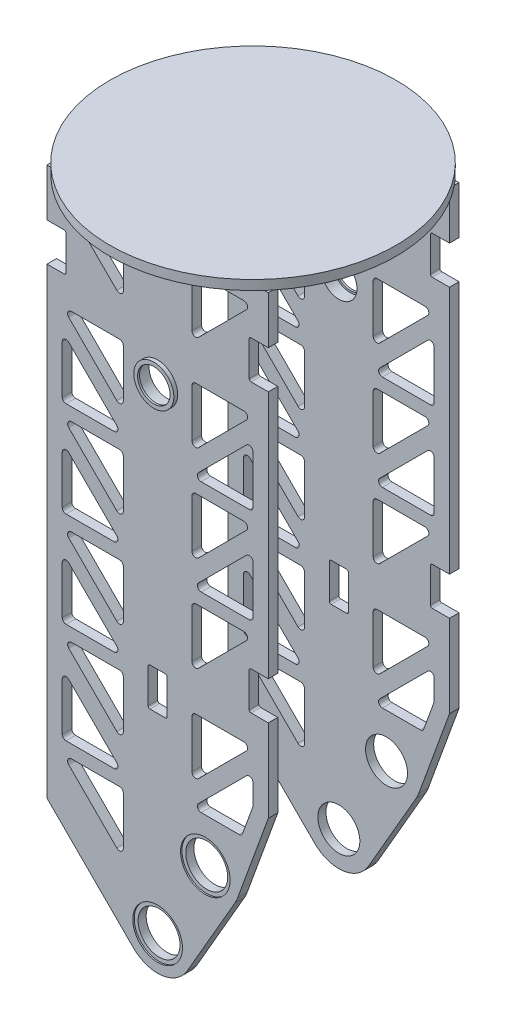
from build123d import *

# Parameters (mm, degrees)
SKETCH_1_R                   = 11
EXTRUDE_564_DEPTH            = 100
EXTRUDE_START                = -100
SKETCH_2_R                   = 11
EXTRUDE_873_DEPTH            = 100
EXTRUDE_2689_DEPTH           = 100
CUT_EXTRUDE_4146_DEPTH       = 534.010318849
CUT_EXTRUDE_4146_DEPTH_BACK  = 534.010318849
SKETCH_3_W                   = 90
SKETCH_3_H                   = 380
SKETCH_5_R                   = 2.5
EXTRUDE_4712_DEPTH           = 100
SKETCH_6_W                   = 191.177045066
SKETCH_6_H                   = 235.084722287
CUT_EXTRUDE_5026_DEPTH       = 84
SKETCH_7_R                   = 75
EXTRUDE_5314_DEPTH           = 5
CUT_EXTRUDE_6096_DEPTH       = 357.195171219
CUT_EXTRUDE_6096_DEPTH_BACK  = 357.195171219
FILLET_2_R                   = 2
MIRROR_START                 = 95
MIRROR_1_DEPTH               = 5
CUT_EXTRUDE_11149_DEPTH      = 357.195171219
CUT_EXTRUDE_11149_DEPTH_BACK = 357.195171219
SKETCH_12_W                  = 10
SKETCH_12_H                  = 20
FILLET_3_R                   = 1
CUT_EXTRUDE_START            = -5
CUT_EXTRUDE_12030_OUTLINE_R  = 5
CUT_EXTRUDE_12030_DEPTH      = 5
CUT_EXTRUDE_7_DEPTH          = 357.195171219
CUT_EXTRUDE_7_DEPTH_BACK     = 357.195171219
SKETCH_14_W                  = 10
SKETCH_14_H                  = 20
FILLET_4_R                   = 1
CUT_EXTRUDE_START_2          = -129
SKETCH_15_R                  = 11
CUT_EXTRUDE_8_DEPTH          = 129
SKETCH_16_R                  = 13
CUT_EXTRUDE_9_DEPTH          = 0.75
CUT_EXTRUDE_START_3          = -0.75
SKETCH_17_R                  = 13
CUT_EXTRUDE_10_DEPTH         = 0.75
SKETCH_18_R                  = 9.5
CUT_EXTRUDE_11_DEPTH         = 113


# Read off the part's stored shape, not the designer's step: 镜向1, 电机安装轴承孔
with BuildPart() as part:
    # 草图1 → Extrude 564 (new body)
    with BuildSketch(Plane.XY):
        with BuildLine():
            Line((-18, 500), (-18, 0))
            ThreePointArc((-18, 0), (0, -18), (18, 0))
            Line((18, 0), (18, 500))
            ThreePointArc((18, 500), (0, 518), (-18, 500))
        make_face()
        with Locations((0, 500)):
            Circle(SKETCH_1_R, mode=Mode.SUBTRACT)
        Circle(SKETCH_1_R, mode=Mode.SUBTRACT)
    extrude(amount=EXTRUDE_564_DEPTH)

    # 草图2 → Extrude 873 (add)
    with BuildSketch(Plane.XY.offset(100).offset(EXTRUDE_START)):
        with BuildLine():
            Line((18, 61.301270189), (25, 61.301270189))
            ThreePointArc((25, 61.301270189), (40.588457268, 52.301270189), (40.588457268, 34.301270189))
            Line((40.588457268, 34.301270189), (15.588457268, -9))
            ThreePointArc((15.588457268, -9), (-4.658742812, -17.386664873), (-18, 0))
            Line((-18, 0), (-18, 61.301270189))
            Line((-18, 61.301270189), (18, 61.301270189))
        make_face()
        with Locations((25, 43.301270189)):
            Circle(SKETCH_2_R, mode=Mode.SUBTRACT)
        Circle(SKETCH_2_R, mode=Mode.SUBTRACT)
    extrude(amount=EXTRUDE_873_DEPTH)

    # 草图10 → Extrude 2689 (add)
    with BuildSketch(Plane(origin=(0, 0, 0), x_dir=(-1, 0, 0), z_dir=(0, 0, -1))):
        with BuildLine():
            Line((-41.914467174, 37.144907609), (-58, 81.339545828))
            Line((-58, 81.339545828), (-58, 320))
            Line((-58, 320), (-18, 320))
            Line((-18, 320), (-18, 61.301270189))
            Line((-18, 61.301270189), (-25, 61.301270189))
            ThreePointArc((-25, 61.301270189), (-39.744736797, 53.625646044), (-41.914467174, 37.144907609))
        make_face()
        with BuildLine():
            Line((12.727922061, -12.727922061), (58, 32.544155877))
            Line((58, 32.544155877), (58, 320))
            Line((58, 320), (18, 320))
            Line((18, 320), (18, 0))
            ThreePointArc((18, 0), (16.629831585, -6.888301783), (12.727922061, -12.727922061))
        make_face()
    extrude(amount=-EXTRUDE_2689_DEPTH)

    # 草图3 → Cut-Extrude 4146 (cut, two sides: drawn at the far end of the back side and taken through both)
    with BuildSketch(Plane.ZY.offset(18).offset(-CUT_EXTRUDE_4146_DEPTH_BACK)):
        with Locations((50, 150)):
            Rectangle(SKETCH_3_W, SKETCH_3_H)
    extrude(amount=CUT_EXTRUDE_4146_DEPTH + CUT_EXTRUDE_4146_DEPTH_BACK, mode=Mode.SUBTRACT)

    # 草图5 → Extrude 4712 (add)
    with BuildSketch(Plane.XY.offset(100)):
        with Locations(Location((0, 250, 0), (0, 0, 90))):
            Circle(SKETCH_5_R)
    extrude(amount=-EXTRUDE_4712_DEPTH)

    # 草图6 → Cut-Extrude 5026 (cut)
    with BuildSketch(Plane(origin=(18, 0, 0), x_dir=(0, 0, -1), z_dir=(1, 0, 0))):
        with Locations((-50.962374235, 437.542361144)):
            Rectangle(SKETCH_6_W, SKETCH_6_H)
    extrude(amount=-CUT_EXTRUDE_5026_DEPTH, mode=Mode.SUBTRACT)

    # 草图7 → Extrude 5314 (add)
    with BuildSketch(Plane(origin=(0, 320, 0), x_dir=(1, 0, 0), z_dir=(0, 1, 0))):
        with Locations(Location((0, -50, 0), (0, 0, 320.654170234))):
            Circle(SKETCH_7_R)
    extrude(amount=EXTRUDE_5314_DEPTH)

    # 草图10<3> → Cut-Extrude 6096 (cut, two sides: drawn at the far end of the back side and taken through both)
    with BuildSketch(Plane(origin=(0, 0, 0), x_dir=(-1, 0, 0), z_dir=(0, 0, -1)).offset(-CUT_EXTRUDE_6096_DEPTH_BACK)):
        Polygon((50, 310), (18, 310), (18, 278), align=None)
        Polygon((-18, 278), (-18, 310), (-50, 310), align=None)
        Polygon((-18, 227.925713543), (-18, 259.925713543), (-50, 259.925713543), align=None)
        Polygon((50, 259.925713543), (18, 259.925713543), (18, 227.925713543), align=None)
        Polygon((50, 248.612005044), (50, 216.612005044), (18, 216.612005044), align=None)
        Polygon((-50, 248.612005044), (-50, 216.612005044), (-18, 216.612005044), align=None)
        Polygon((-18, 177.851427085), (-18, 209.851427085), (-50, 209.851427085), align=None)
        Polygon((50, 209.851427085), (18, 209.851427085), (18, 177.851427085), align=None)
        Polygon((50, 198.537718586), (50, 166.537718586), (18, 166.537718586), align=None)
        Polygon((-50, 198.537718586), (-50, 166.537718586), (-18, 166.537718586), align=None)
        Polygon((-50, 159.777140628), (-18, 127.777140628), (-18, 159.777140628), align=None)
        Polygon((18, 159.777140628), (18, 127.777140628), (50, 159.777140628), align=None)
        Polygon((-50, 109.702854171), (-18, 77.702854171), (-18, 109.702854171), align=None)
        Polygon((18, 109.702854171), (18, 77.702854171), (50, 109.702854171), align=None)
        Polygon((-50, 98.389145672), (-50, 82.750161674), (-44.045077173, 66.389145672), (-18, 66.389145672), align=None)
        Polygon((18, 56.800140588), (18, 24.800140588), (50, 56.800140588), align=None)
        Polygon((50, 95.560718547), (50, 63.560718547), (18, 63.560718547), align=None)
        Polygon((50, 116.463432129), (18, 116.463432129), (50, 148.463432129), align=None)
    extrude(amount=CUT_EXTRUDE_6096_DEPTH + CUT_EXTRUDE_6096_DEPTH_BACK, mode=Mode.SUBTRACT)

    # 圆角2
    fillet_2_edges = [part.edges().sort_by_distance(p)[0] for p in [
        (50, 109.702854171, 2.5),
        (18, 109.702854171, 2.5),
        (18, 77.702854171, 2.5),
        (-18, 159.777140628, 2.5),
        (-50, 159.777140628, 2.5),
        (-18, 127.777140628, 2.5),
        (50, 159.777140628, 2.5),
        (18, 159.777140628, 2.5),
        (18, 127.777140628, 2.5),
        (50, 166.537718586, 2.5),
        (50, 198.537718586, 2.5),
        (18, 166.537718586, 2.5),
        (-50, 63.560718547, 2.5),
        (-18, 63.560718547, 2.5),
        (-50, 95.560718547, 2.5),
        (-50, 56.800140588, 2.5),
        (-18, 24.800140588, 2.5),
        (-18, 56.800140588, 2.5),
        (50, 82.750161674, 2.5),
        (50, 98.389145672, 2.5),
        (18, 66.389145672, 2.5),
        (44.045077173, 66.389145672, 2.5),
        (-18, 109.702854171, 2.5),
        (-50, 109.702854171, 2.5),
        (-18, 77.702854171, 2.5),
        (50, 310, 2.5),
        (18, 310, 2.5),
        (18, 278, 2.5),
        (50, 259.925713543, 2.5),
        (18, 259.925713543, 2.5),
        (18, 227.925713543, 2.5),
        (-50, 248.612005044, 2.5),
        (-50, 216.612005044, 2.5),
        (-18, 216.612005044, 2.5),
        (-18, 259.925713543, 2.5),
        (-50, 259.925713543, 2.5),
        (-18, 227.925713543, 2.5),
        (50, 216.612005044, 2.5),
        (50, 248.612005044, 2.5),
        (18, 216.612005044, 2.5),
        (50, 209.851427085, 2.5),
        (18, 209.851427085, 2.5),
        (18, 177.851427085, 2.5),
        (-50, 198.537718586, 2.5),
        (-50, 166.537718586, 2.5),
        (-18, 166.537718586, 2.5),
        (-18, 209.851427085, 2.5),
        (-50, 209.851427085, 2.5),
        (-18, 177.851427085, 2.5),
        (-50, 148.463432129, 2.5),
        (-50, 116.463432129, 2.5),
        (-18, 116.463432129, 2.5),
        (-18, 310, 2.5),
        (-50, 310, 2.5),
        (-18, 278, 2.5),
    ]]
    fillet(fillet_2_edges, radius=FILLET_2_R)

    # 镜向1 outline → 镜向1 (add)
    with BuildSketch(Plane.XY.offset(MIRROR_START)):
        with BuildLine():
            ThreePointArc((-50, 143.635005004), (-48.765366865, 145.482764069), (-46.585786438, 145.049218567))
            Line((-46.585786438, 145.049218567), (-50, 148.463432129))
            Line((-50, 148.463432129), (-50, 143.635005004))
        make_face()
        with BuildLine():
            Line((-18, 116.463432129), (-21.414213562, 119.877645691))
            ThreePointArc((-21.414213562, 119.877645691), (-20.98066806, 117.698065264), (-22.828427125, 116.463432129))
            Line((-22.828427125, 116.463432129), (-18, 116.463432129))
        make_face()
        with BuildLine():
            ThreePointArc((-48, 116.463432129), (-49.414213562, 117.049218567), (-50, 118.463432129))
            Line((-50, 118.463432129), (-50, 116.463432129))
            Line((-50, 116.463432129), (-48, 116.463432129))
        make_face()
        with BuildLine():
            ThreePointArc((-20, 310), (-18.585786438, 309.414213562), (-18, 308))
            Line((-18, 308), (-18, 310))
            Line((-18, 310), (-20, 310))
        make_face()
        with BuildLine():
            Line((-18, 278), (-18, 282.828427125))
            ThreePointArc((-18, 282.828427125), (-19.234633135, 280.98066806), (-21.414213562, 281.414213562))
            Line((-21.414213562, 281.414213562), (-18, 278))
        make_face()
        with BuildLine():
            ThreePointArc((-46.585786438, 306.585786438), (-47.01933194, 308.765366865), (-45.171572875, 310))
            Line((-45.171572875, 310), (-50, 310))
            Line((-50, 310), (-46.585786438, 306.585786438))
        make_face()
        with BuildLine():
            ThreePointArc((-20, 259.925713543), (-18.585786438, 259.339927105), (-18, 257.925713543))
            Line((-18, 257.925713543), (-18, 259.925713543))
            Line((-18, 259.925713543), (-20, 259.925713543))
        make_face()
        with BuildLine():
            Line((-18, 227.925713543), (-18, 232.754140667))
            ThreePointArc((-18, 232.754140667), (-19.234633135, 230.906381602), (-21.414213562, 231.339927105))
            Line((-21.414213562, 231.339927105), (-18, 227.925713543))
        make_face()
        with BuildLine():
            ThreePointArc((-46.585786438, 256.51149998), (-47.01933194, 258.691080407), (-45.171572875, 259.925713543))
            Line((-45.171572875, 259.925713543), (-50, 259.925713543))
            Line((-50, 259.925713543), (-46.585786438, 256.51149998))
        make_face()
        with BuildLine():
            ThreePointArc((-50, 243.783577919), (-48.765366865, 245.631336984), (-46.585786438, 245.197791481))
            Line((-46.585786438, 245.197791481), (-50, 248.612005044))
            Line((-50, 248.612005044), (-50, 243.783577919))
        make_face()
        with BuildLine():
            Line((-18, 216.612005044), (-21.414213562, 220.026218606))
            ThreePointArc((-21.414213562, 220.026218606), (-20.98066806, 217.846638179), (-22.828427125, 216.612005044))
            Line((-22.828427125, 216.612005044), (-18, 216.612005044))
        make_face()
        with BuildLine():
            ThreePointArc((-48, 216.612005044), (-49.414213563, 217.197791481), (-50, 218.612005044))
            Line((-50, 218.612005044), (-50, 216.612005044))
            Line((-50, 216.612005044), (-48, 216.612005044))
        make_face()
        with BuildLine():
            ThreePointArc((-20, 209.851427085), (-18.585786438, 209.265640647), (-18, 207.851427085))
            Line((-18, 207.851427085), (-18, 209.851427085))
            Line((-18, 209.851427085), (-20, 209.851427085))
        make_face()
        with BuildLine():
            Line((-18, 177.851427085), (-18, 182.67985421))
            ThreePointArc((-18, 182.67985421), (-19.234633135, 180.832095145), (-21.414213562, 181.265640648))
            Line((-21.414213562, 181.265640648), (-18, 177.851427085))
        make_face()
        with BuildLine():
            ThreePointArc((-46.585786438, 206.437213523), (-47.01933194, 208.61679395), (-45.171572875, 209.851427085))
            Line((-45.171572875, 209.851427085), (-50, 209.851427085))
            Line((-50, 209.851427085), (-46.585786438, 206.437213523))
        make_face()
        with BuildLine():
            ThreePointArc((-50, 193.709291462), (-48.765366865, 195.557050527), (-46.585786438, 195.123505024))
            Line((-46.585786438, 195.123505024), (-50, 198.537718586))
            Line((-50, 198.537718586), (-50, 193.709291462))
        make_face()
        with BuildLine():
            Line((-18, 166.537718586), (-21.414213562, 169.951932149))
            ThreePointArc((-21.414213562, 169.951932149), (-20.98066806, 167.772351722), (-22.828427125, 166.537718586))
            Line((-22.828427125, 166.537718586), (-18, 166.537718586))
        make_face()
        with BuildLine():
            ThreePointArc((-48, 166.537718586), (-49.414213562, 167.123505024), (-50, 168.537718586))
            Line((-50, 168.537718586), (-50, 166.537718586))
            Line((-50, 166.537718586), (-48, 166.537718586))
        make_face()
        with BuildLine():
            ThreePointArc((-20, 159.777140628), (-18.585786438, 159.19135419), (-18, 157.777140628))
            Line((-18, 157.777140628), (-18, 159.777140628))
            Line((-18, 159.777140628), (-20, 159.777140628))
        make_face()
        with BuildLine():
            Line((-18, 127.777140628), (-18, 132.605567753))
            ThreePointArc((-18, 132.605567753), (-19.234633135, 130.757808688), (-21.414213562, 131.19135419))
            Line((-21.414213562, 131.19135419), (-18, 127.777140628))
        make_face()
        with BuildLine():
            ThreePointArc((-46.585786438, 156.362927066), (-47.01933194, 158.542507493), (-45.171572875, 159.777140628))
            Line((-45.171572875, 159.777140628), (-50, 159.777140628))
            Line((-50, 159.777140628), (-46.585786438, 156.362927066))
        make_face()
        with BuildLine():
            ThreePointArc((-20, 109.702854171), (-18.585786438, 109.117067733), (-18, 107.702854171))
            Line((-18, 107.702854171), (-18, 109.702854171))
            Line((-18, 109.702854171), (-20, 109.702854171))
        make_face()
        with BuildLine():
            Line((-18, 77.702854171), (-18, 82.531281295))
            ThreePointArc((-18, 82.531281295), (-19.234633135, 80.68352223), (-21.414213562, 81.117067733))
            Line((-21.414213562, 81.117067733), (-18, 77.702854171))
        make_face()
        with BuildLine():
            ThreePointArc((-46.585786438, 106.288640608), (-47.01933194, 108.468221035), (-45.171572875, 109.702854171))
            Line((-45.171572875, 109.702854171), (-50, 109.702854171))
            Line((-50, 109.702854171), (-46.585786438, 106.288640608))
        make_face()
        with BuildLine():
            ThreePointArc((-50, 90.732291422), (-48.765366865, 92.580050487), (-46.585786438, 92.146504984))
            Line((-46.585786438, 92.146504984), (-50, 95.560718547))
            Line((-50, 95.560718547), (-50, 90.732291422))
        make_face()
        with BuildLine():
            Line((-18, 63.560718547), (-21.414213562, 66.974932109))
            ThreePointArc((-21.414213562, 66.974932109), (-20.98066806, 64.795351682), (-22.828427125, 63.560718547))
            Line((-22.828427125, 63.560718547), (-18, 63.560718547))
        make_face()
        with BuildLine():
            ThreePointArc((-48, 63.560718547), (-49.414213562, 64.146504984), (-50, 65.560718547))
            Line((-50, 65.560718547), (-50, 63.560718547))
            Line((-50, 63.560718547), (-48, 63.560718547))
        make_face()
        with BuildLine():
            ThreePointArc((-46.585786438, 53.385927026), (-47.01933194, 55.565507453), (-45.171572875, 56.800140588))
            Line((-45.171572875, 56.800140588), (-50, 56.800140588))
            Line((-50, 56.800140588), (-46.585786438, 53.385927026))
        make_face()
        with BuildLine():
            Line((-18, 56.800140588), (-20, 56.800140588))
            ThreePointArc((-20, 56.800140588), (-18.585786437, 56.214354151), (-18, 54.800140588))
            Line((-18, 54.800140588), (-18, 56.800140588))
        make_face()
        with BuildLine():
            ThreePointArc((-18, 29.628567713), (-19.234633135, 27.780808648), (-21.414213562, 28.214354151))
            Line((-21.414213562, 28.214354151), (-18, 24.800140588))
            Line((-18, 24.800140588), (-18, 29.628567713))
        make_face()
        with BuildLine():
            ThreePointArc((46.585786438, 94.974932109), (48.765366865, 95.408477612), (50, 93.560718547))
            Line((50, 93.560718547), (50, 98.389145672))
            Line((50, 98.389145672), (46.585786438, 94.974932109))
        make_face()
        with BuildLine():
            Line((50, 82.750161674), (50, 83.102815635))
            ThreePointArc((50, 83.102815635), (49.969615506, 82.75551928), (49.879385242, 82.418775349))
            Line((49.879385242, 82.418775349), (50, 82.750161674))
        make_face()
        with BuildLine():
            ThreePointArc((22.828427125, 66.389145672), (20.98066806, 67.623778807), (21.414213562, 69.803359234))
            Line((21.414213562, 69.803359234), (18, 66.389145672))
            Line((18, 66.389145672), (22.828427125, 66.389145672))
        make_face()
        with BuildLine():
            Line((44.045077173, 66.389145672), (44.524047338, 67.705105385))
            ThreePointArc((44.524047338, 67.705105385), (43.791814969, 66.750841583), (42.644662096, 66.389145672))
            Line((42.644662096, 66.389145672), (44.045077173, 66.389145672))
        make_face()
        with BuildLine():
            Line((18, 109.702854171), (18, 107.702854171))
            ThreePointArc((18, 107.702854171), (18.585786438, 109.117067733), (20, 109.702854171))
            Line((20, 109.702854171), (18, 109.702854171))
        make_face()
        with BuildLine():
            ThreePointArc((21.414213562, 81.117067733), (19.234633135, 80.68352223), (18, 82.531281295))
            Line((18, 82.531281295), (18, 77.702854171))
            Line((18, 77.702854171), (21.414213562, 81.117067733))
        make_face()
        with BuildLine():
            Line((50, 109.702854171), (45.171572875, 109.702854171))
            ThreePointArc((45.171572875, 109.702854171), (47.01933194, 108.468221035), (46.585786438, 106.288640608))
            Line((46.585786438, 106.288640608), (50, 109.702854171))
        make_face()
        with BuildLine():
            Line((18, 159.777140628), (18, 157.777140628))
            ThreePointArc((18, 157.777140628), (18.585786438, 159.19135419), (20, 159.777140628))
            Line((20, 159.777140628), (18, 159.777140628))
        make_face()
        with BuildLine():
            ThreePointArc((21.414213562, 131.19135419), (19.234633135, 130.757808688), (18, 132.605567753))
            Line((18, 132.605567753), (18, 127.777140628))
            Line((18, 127.777140628), (21.414213562, 131.19135419))
        make_face()
        with BuildLine():
            Line((50, 159.777140628), (45.171572875, 159.777140628))
            ThreePointArc((45.171572875, 159.777140628), (47.01933194, 158.542507493), (46.585786438, 156.362927066))
            Line((46.585786438, 156.362927066), (50, 159.777140628))
        make_face()
        with BuildLine():
            ThreePointArc((50, 168.537718586), (49.414213562, 167.123505024), (48, 166.537718586))
            Line((48, 166.537718586), (50, 166.537718586))
            Line((50, 166.537718586), (50, 168.537718586))
        make_face()
        with BuildLine():
            Line((18, 166.537718586), (22.828427125, 166.537718586))
            ThreePointArc((22.828427125, 166.537718586), (20.98066806, 167.772351722), (21.414213562, 169.951932149))
            Line((21.414213562, 169.951932149), (18, 166.537718586))
        make_face()
        with BuildLine():
            ThreePointArc((46.585786438, 195.123505024), (48.765366865, 195.557050527), (50, 193.709291462))
            Line((50, 193.709291462), (50, 198.537718586))
            Line((50, 198.537718586), (46.585786438, 195.123505024))
        make_face()
        with BuildLine():
            Line((18, 177.851427085), (21.414213562, 181.265640648))
            ThreePointArc((21.414213562, 181.265640648), (19.234633135, 180.832095145), (18, 182.67985421))
            Line((18, 182.67985421), (18, 177.851427085))
        make_face()
        with BuildLine():
            ThreePointArc((45.171572875, 209.851427085), (47.01933194, 208.61679395), (46.585786438, 206.437213523))
            Line((46.585786438, 206.437213523), (50, 209.851427085))
            Line((50, 209.851427085), (45.171572875, 209.851427085))
        make_face()
        with BuildLine():
            Line((18, 209.851427085), (18, 207.851427085))
            ThreePointArc((18, 207.851427085), (18.585786438, 209.265640647), (20, 209.851427085))
            Line((20, 209.851427085), (18, 209.851427085))
        make_face()
        with BuildLine():
            ThreePointArc((50, 218.612005044), (49.414213563, 217.197791481), (48, 216.612005044))
            Line((48, 216.612005044), (50, 216.612005044))
            Line((50, 216.612005044), (50, 218.612005044))
        make_face()
        with BuildLine():
            Line((18, 216.612005044), (22.828427125, 216.612005044))
            ThreePointArc((22.828427125, 216.612005044), (20.98066806, 217.846638179), (21.414213562, 220.026218606))
            Line((21.414213562, 220.026218606), (18, 216.612005044))
        make_face()
        with BuildLine():
            ThreePointArc((46.585786438, 245.197791481), (48.765366865, 245.631336984), (50, 243.783577919))
            Line((50, 243.783577919), (50, 248.612005044))
            Line((50, 248.612005044), (46.585786438, 245.197791481))
        make_face()
        with BuildLine():
            Line((18, 227.925713543), (21.414213562, 231.339927105))
            ThreePointArc((21.414213562, 231.339927105), (19.234633135, 230.906381602), (18, 232.754140667))
            Line((18, 232.754140667), (18, 227.925713543))
        make_face()
        with BuildLine():
            ThreePointArc((45.171572875, 259.925713543), (47.01933194, 258.691080407), (46.585786438, 256.51149998))
            Line((46.585786438, 256.51149998), (50, 259.925713543))
            Line((50, 259.925713543), (45.171572875, 259.925713543))
        make_face()
        with BuildLine():
            Line((18, 259.925713543), (18, 257.925713543))
            ThreePointArc((18, 257.925713543), (18.585786438, 259.339927105), (20, 259.925713543))
            Line((20, 259.925713543), (18, 259.925713543))
        make_face()
        with BuildLine():
            Line((18, 278), (21.414213562, 281.414213562))
            ThreePointArc((21.414213562, 281.414213562), (19.234633135, 280.98066806), (18, 282.828427125))
            Line((18, 282.828427125), (18, 278))
        make_face()
        with BuildLine():
            ThreePointArc((45.171572875, 310), (47.01933194, 308.765366865), (46.585786438, 306.585786438))
            Line((46.585786438, 306.585786438), (50, 310))
            Line((50, 310), (45.171572875, 310))
        make_face()
        with BuildLine():
            Line((18, 310), (18, 308))
            ThreePointArc((18, 308), (18.585786438, 309.414213562), (20, 310))
            Line((20, 310), (18, 310))
        make_face()
    extrude(amount=MIRROR_1_DEPTH)

    # 草图12 → Cut-Extrude 11149 (cut, two sides: drawn at the far end of the back side and taken through both)
    with BuildSketch(Plane(origin=(0, 0, 0), x_dir=(-1, 0, 0), z_dir=(0, 0, -1)).offset(-CUT_EXTRUDE_11149_DEPTH_BACK)):
        with Locations((-53, 285)):
            Rectangle(SKETCH_12_W, SKETCH_12_H)
        with Locations((-53, 134.702854171)):
            Rectangle(SKETCH_12_W, SKETCH_12_H)
        with Locations((53, 285)):
            Rectangle(SKETCH_12_W, SKETCH_12_H)
    extrude(amount=CUT_EXTRUDE_11149_DEPTH + CUT_EXTRUDE_11149_DEPTH_BACK, mode=Mode.SUBTRACT)

    # 圆角3
    fillet_3_edges = [part.edges().sort_by_distance(p)[0] for p in [
        (-48, 275, 2.5),
        (-48, 295, 2.5),
        (-48, 275, 97.5),
        (-48, 295, 97.5),
        (48, 144.702854171, 2.5),
        (48, 124.702854171, 2.5),
        (48, 144.702854171, 97.5),
        (48, 124.702854171, 97.5),
        (48, 295, 2.5),
        (48, 275, 2.5),
        (48, 295, 97.5),
        (48, 275, 97.5),
    ]]
    fillet(fillet_3_edges, radius=FILLET_3_R)

    # Cut-Extrude 12030 outline → Cut-Extrude 12030 (cut)
    with BuildSketch(Plane.XY.offset(5).offset(CUT_EXTRUDE_START)):
        with Locations((0, 250)):
            Circle(CUT_EXTRUDE_12030_OUTLINE_R)
    cut_extrude_12030 = extrude(amount=CUT_EXTRUDE_12030_DEPTH, mode=Mode.SUBTRACT)

    # 镜向2: Cut-Extrude 12030 across plane
    add(cut_extrude_12030.mirror(Plane(origin=(0, 0, 50), x_dir=(1, 0, 0), z_dir=(0, 0, -1))), mode=Mode.SUBTRACT)

    # 草图14 → 切除-拉伸7 (cut, two sides: drawn at the far end of the back side and taken through both)
    with BuildSketch(Plane(origin=(0, 0, 0), x_dir=(-1, 0, 0), z_dir=(0, 0, -1)).offset(-CUT_EXTRUDE_7_DEPTH_BACK)):
        with Locations((0, 110)):
            Rectangle(SKETCH_14_W, SKETCH_14_H)
    extrude(amount=CUT_EXTRUDE_7_DEPTH + CUT_EXTRUDE_7_DEPTH_BACK, mode=Mode.SUBTRACT)

    # 圆角4
    fillet_4_edges = [part.edges().sort_by_distance(p)[0] for p in [
        (5, 100, 2.5),
        (5, 120, 2.5),
        (-5, 120, 2.5),
        (-5, 100, 2.5),
        (5, 100, 97.5),
        (5, 120, 97.5),
        (-5, 120, 97.5),
        (-5, 100, 97.5),
    ]]
    fillet(fillet_4_edges, radius=FILLET_4_R)

    # 草图15 → 切除-拉伸8 (cut)
    with BuildSketch(Plane.XY.offset(100).offset(CUT_EXTRUDE_START_2)):
        with Locations((25, 43.301270189)):
            Circle(SKETCH_15_R)
    extrude(amount=CUT_EXTRUDE_8_DEPTH, mode=Mode.SUBTRACT)

    # 草图16 → 切除-拉伸9 (cut)
    with BuildSketch(Plane.XY.offset(100)):
        with Locations((25, 43.301270189)):
            Circle(SKETCH_16_R)
        Circle(SKETCH_16_R)
    extrude(amount=-CUT_EXTRUDE_9_DEPTH, mode=Mode.SUBTRACT)

    # 草图17 → 切除-拉伸10 (cut)
    with BuildSketch(Plane(origin=(0, 0, 0), x_dir=(-1, 0, 0), z_dir=(0, 0, -1)).offset(CUT_EXTRUDE_START_3)):
        with Locations(Location((0, 0, 0), (0, 0, 180))):
            Circle(SKETCH_17_R)
        with Locations(Location((-25, 43.301270189, 0), (0, 0, 180))):
            Circle(SKETCH_17_R)
    extrude(amount=CUT_EXTRUDE_10_DEPTH, mode=Mode.SUBTRACT)

    # 草图18 → 切除-拉伸11 (cut)
    with BuildSketch(Plane.XY.offset(100)):
        with Locations((0, 250)):
            Circle(SKETCH_18_R)
    extrude(amount=-CUT_EXTRUDE_11_DEPTH, mode=Mode.SUBTRACT)

    # 草图19 → 旋转1 (revolve)
    with BuildSketch(Plane(origin=(0, 0, 0), x_dir=(0, 0, -1), z_dir=(1, 0, 0)), mode=Mode.PRIVATE) as revolve_1_sk:
        Polygon((0, 239.5), (2, 239.5), (2, 241.5), (1, 241.5), (1, 240.5), (0, 240.5), align=None)
        Polygon((-100, 239.5), (-102, 239.5), (-102, 241.5), (-101, 241.5), (-101, 240.5), (-100, 240.5), align=None)
    revolve(revolve_1_sk.sketch.rotate(Axis((0, 250, 0), (0, 0, 1)), 270), axis=Axis((0, 250, 0), (0, 0, 1)))


solid = part.part
